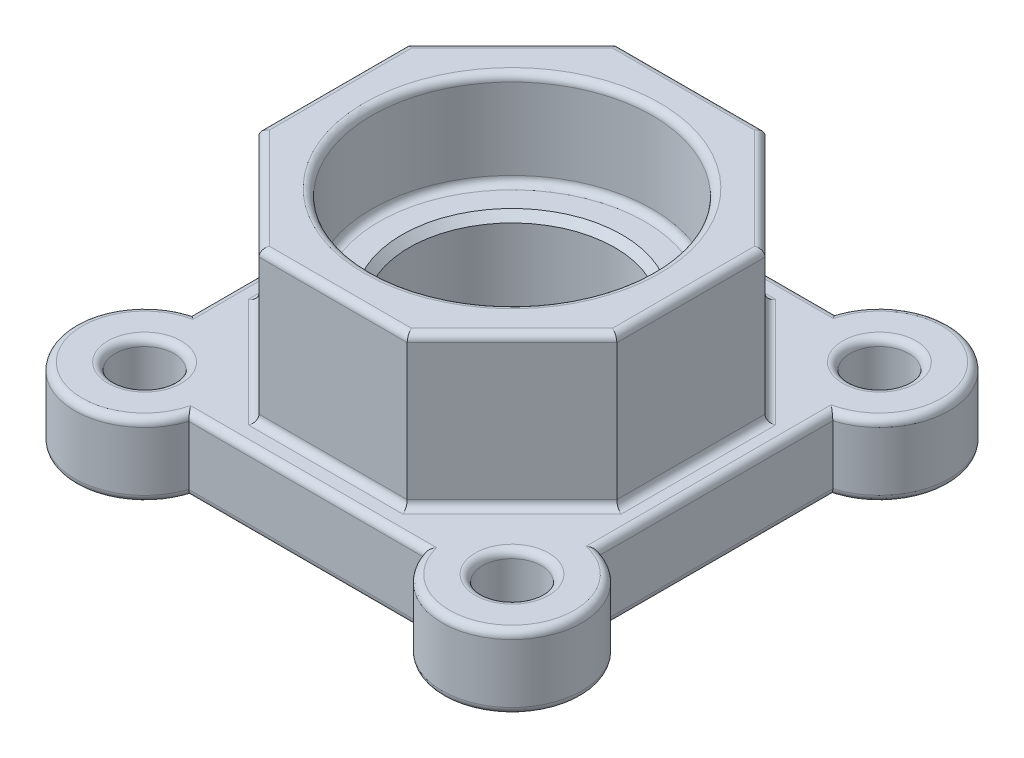
from build123d import *
from build123d.topology import SkipClean

# Parameters (mm, degrees)
SKETCH1_W           = 55.5
SKETCH1_H           = 56
BOSS_EXTRUDE1_DEPTH = 10
BOSS_EXTRUDE2_DEPTH = 10
SKETCH2_3_R         = 4
CUT_EXTRUDE1_DEPTH  = 10
FILLET1_R           = 1
SKETCH3_R           = 19.1
BOSS_EXTRUDE3_DEPTH = 20.5
SKETCH3_3_R         = 19.1
SKETCH3_3_R_2       = 14
BOSS_EXTRUDE4_DEPTH = 7.5
CUT_EXTRUDE2_START  = -5.5
SKETCH3_4_R         = 14
CUT_EXTRUDE2_DEPTH  = 5.5
SKETCH3_5_R         = 12.5
CUT_EXTRUDE3_DEPTH  = 10
CHAMFER1_SIZE       = 1
FILLET2_R           = 1
FILLET3_R           = 1
FILLET4_R           = 1
FILLET5_R           = 1
CHAMFER2_SIZE2      = 1.37373871
CHAMFER2_SIZE       = 0.5


with BuildPart() as part:
    # Sketch1 → Boss-Extrude1 (new body)
    with BuildSketch(Plane(origin=(0, 0, 0), x_dir=(1, 0, 0), z_dir=(0, 1, 0))):
        with Locations((27.75, 28)):
            Rectangle(SKETCH1_W, SKETCH1_H)
    extrude(amount=BOSS_EXTRUDE1_DEPTH)

    # Sketch2 → Boss-Extrude2 (add)
    with BuildSketch(Plane(origin=(0, 10, 0), x_dir=(1, 0, 0), z_dir=(0, 1, 0))):
        with BuildLine():
            Line((0, 50.09526249), (0, 43.90673326))
            ThreePointArc((0, 43.90673326), (8.412375826, 45.371926849), (12.25, 53))
            ThreePointArc((12.25, 53), (12.127682091, 54.519565268), (11.763878189, 56))
            Line((11.763878189, 56), (5.395751311, 56))
            ThreePointArc((5.395751311, 56), (6.395751311, 54.645751311), (6.75, 53))
            ThreePointArc((6.75, 53), (4.33113883, 49.325765386), (0, 50.09526249))
        make_face()
        with BuildLine():
            ThreePointArc((11.763878189, 56), (-4.059612148, 59.624136351), (0, 43.90673326))
            Line((0, 43.90673326), (0, 50.09526249))
            ThreePointArc((0, 50.09526249), (-1.25, 53), (0, 55.90473751))
            Line((0, 55.90473751), (0, 56))
            Line((0, 56), (0.104248689, 56))
            ThreePointArc((0.104248689, 56), (2.75, 57), (5.395751311, 56))
            Line((5.395751311, 56), (11.763878189, 56))
        make_face()
        with BuildLine():
            ThreePointArc((11.763878189, 0), (12.127682091, 1.480434732), (12.25, 3))
            ThreePointArc((12.25, 3), (8.412375826, 10.628073151), (0, 12.09326674))
            Line((0, 12.09326674), (0, 5.90473751))
            ThreePointArc((0, 5.90473751), (4.33113883, 6.674234614), (6.75, 3))
            ThreePointArc((6.75, 3), (6.395751311, 1.354248689), (5.395751311, 0))
            Line((5.395751311, 0), (11.763878189, 0))
        make_face()
        with BuildLine():
            Line((0, 5.90473751), (0, 12.09326674))
            ThreePointArc((0, 12.09326674), (-4.059612148, -3.624136351), (11.763878189, 0))
            Line((11.763878189, 0), (5.395751311, 0))
            ThreePointArc((5.395751311, 0), (2.75, -1), (0.104248689, 0))
            Line((0.104248689, 0), (0, 0))
            Line((0, 0), (0, 0.09526249))
            ThreePointArc((0, 0.09526249), (-1.25, 3), (0, 5.90473751))
        make_face()
        with BuildLine():
            Line((50.104248689, 0), (43.736121811, 0))
            ThreePointArc((43.736121811, 0), (54.269565268, -6.377682091), (62.25, 3))
            ThreePointArc((62.25, 3), (60.378073151, 8.662375826), (55.5, 12.09326674))
            Line((55.5, 12.09326674), (55.5, 5.90473751))
            ThreePointArc((55.5, 5.90473751), (56.424234614, 4.58113883), (56.75, 3))
            ThreePointArc((56.75, 3), (56.424234614, 1.41886117), (55.5, 0.09526249))
            Line((55.5, 0.09526249), (55.5, 0))
            Line((55.5, 0), (55.395751311, 0))
            ThreePointArc((55.395751311, 0), (52.75, -1), (50.104248689, 0))
        make_face()
        with BuildLine():
            ThreePointArc((55.5, 12.09326674), (45.940387852, 9.624136351), (43.736121811, 0))
            Line((43.736121811, 0), (50.104248689, 0))
            ThreePointArc((50.104248689, 0), (49.797171151, 5.69829609), (55.5, 5.90473751))
            Line((55.5, 5.90473751), (55.5, 12.09326674))
        make_face()
        with BuildLine():
            Line((50.104248689, 56), (43.736121811, 56))
            ThreePointArc((43.736121811, 56), (45.940387852, 46.375863649), (55.5, 43.90673326))
            Line((55.5, 43.90673326), (55.5, 50.09526249))
            ThreePointArc((55.5, 50.09526249), (49.797171151, 50.30170391), (50.104248689, 56))
        make_face()
        with BuildLine():
            ThreePointArc((62.25, 53), (54.269565268, 62.377682091), (43.736121811, 56))
            Line((43.736121811, 56), (50.104248689, 56))
            ThreePointArc((50.104248689, 56), (52.75, 57), (55.395751311, 56))
            Line((55.395751311, 56), (55.5, 56))
            Line((55.5, 56), (55.5, 55.90473751))
            ThreePointArc((55.5, 55.90473751), (56.424234614, 54.58113883), (56.75, 53))
            ThreePointArc((56.75, 53), (56.424234614, 51.41886117), (55.5, 50.09526249))
            Line((55.5, 50.09526249), (55.5, 43.90673326))
            ThreePointArc((55.5, 43.90673326), (60.378073151, 47.337624174), (62.25, 53))
        make_face()
    extrude(amount=-BOSS_EXTRUDE2_DEPTH)

    # Sketch2<3> → Cut-Extrude1 (cut)
    with SkipClean():  # the faces are left unmerged after this step: merging them gives an invalid solid
        with BuildSketch(Plane(origin=(0, 10, 0), x_dir=(1, 0, 0), z_dir=(0, 1, 0))):
            with Locations(Location((2.75, 3, 0), (0, 0, 270))):
                Circle(SKETCH2_3_R)
            with Locations(Location((52.75, 3, 0), (0, 0, 270))):
                Circle(SKETCH2_3_R)
            with Locations(Location((52.75, 53, 0), (0, 0, 270))):
                Circle(SKETCH2_3_R)
            with Locations(Location((2.75, 53, 0), (0, 0, 270))):
                Circle(SKETCH2_3_R)
        extrude(amount=-CUT_EXTRUDE1_DEPTH, mode=Mode.SUBTRACT)

    # Fillet1
    fillet1_edges = [part.edges().sort_by_distance(p)[0] for p in [
        (0, 0, -28),
        (0, 10, -28),
        (1.269957777, 10, -49.2838898),
        (-4.059612148, 0, -59.624136351),
        (1.269957777, 0, -49.2838898),
        (-4.059612148, 10, -59.624136351),
        (27.75, 0, 0),
        (27.75, 10, 0),
        (1.335786438, 10, 0.741657387),
        (-4.059612148, 0, 3.624136351),
        (1.335786438, 0, 0.741657387),
        (-4.059612148, 10, 3.624136351),
        (55.5, 0, -28),
        (55.5, 10, -28),
        (51.335786438, 10, 0.741657387),
        (59.559612148, 0, 3.624136351),
        (51.335786438, 0, 0.741657387),
        (59.559612148, 10, 3.624136351),
        (27.75, 0, -56),
        (27.75, 10, -56),
        (49.008342613, 10, -51.585786438),
        (59.559612148, 0, -59.624136351),
        (49.008342613, 0, -51.585786438),
        (59.559612148, 10, -59.624136351),
    ]]
    fillet(fillet1_edges, radius=FILLET1_R)

    # Sketch3 → Boss-Extrude3 (add)
    with SkipClean():  # the faces are left unmerged after this step: merging them gives an invalid solid
        with BuildSketch(Plane(origin=(0, 10, 0), x_dir=(1, 0, 0), z_dir=(0, 1, 0))):
            Polygon((52.1, 17.913899756), (52.1, 38.086100244), (37.836100244, 52.35), (17.663899756, 52.35), (3.4, 38.086100244), (3.4, 17.913899756), (17.663899756, 3.65), (37.836100244, 3.65), align=None)
            with Locations(Location((27.75, 28, 0), (0, 0, 270))):
                Circle(SKETCH3_R, mode=Mode.SUBTRACT)
        extrude(amount=BOSS_EXTRUDE3_DEPTH)

    # Sketch3<3> → Boss-Extrude4 (add)
    with SkipClean():  # the faces are left unmerged after this step: merging them gives an invalid solid
        with BuildSketch(Plane(origin=(0, 10, 0), x_dir=(1, 0, 0), z_dir=(0, 1, 0))):
            with Locations(Location((27.75, 28, 0), (0, 0, 270))):
                Circle(SKETCH3_3_R)
            with Locations(Location((27.75, 28, 0), (0, 0, 270))):
                Circle(SKETCH3_3_R_2, mode=Mode.SUBTRACT)
        extrude(amount=BOSS_EXTRUDE4_DEPTH)

    # Sketch3<4> → Cut-Extrude2 (cut)
    with SkipClean():  # the faces are left unmerged after this step: merging them gives an invalid solid
        with BuildSketch(Plane(origin=(0, 10, 0), x_dir=(1, 0, 0), z_dir=(0, 1, 0)).offset(CUT_EXTRUDE2_START)):
            with Locations(Location((27.75, 28, 0), (0, 0, 270))):
                Circle(SKETCH3_4_R)
        extrude(amount=CUT_EXTRUDE2_DEPTH, mode=Mode.SUBTRACT)

    # Sketch3<5> → Cut-Extrude3 (cut)
    with SkipClean():  # the faces are left unmerged after this step: merging them gives an invalid solid
        with BuildSketch(Plane(origin=(0, 10, 0), x_dir=(1, 0, 0), z_dir=(0, 1, 0))):
            with Locations(Location((27.75, 28, 0), (0, 0, 270))):
                Circle(SKETCH3_5_R)
        extrude(amount=-CUT_EXTRUDE3_DEPTH, mode=Mode.SUBTRACT)

    # Chamfer1
    chamfer1_edges = [part.edges().sort_by_distance(p)[0] for p in [
        (27.75, 17.5, -42),
    ]]
    chamfer(chamfer1_edges, length=CHAMFER1_SIZE)

    # Fillet2
    fillet2_edges = [part.edges().sort_by_distance(p)[0] for p in [
        (52.1, 10, -28),
        (44.968050122, 10, -45.218050122),
        (27.75, 10, -52.35),
        (10.531949878, 10, -45.218050122),
        (3.4, 10, -28),
        (10.531949878, 10, -10.781949878),
        (27.75, 10, -3.65),
        (44.968050122, 10, -10.781949878),
    ]]
    fillet(fillet2_edges, radius=FILLET2_R)

    # Fillet3
    fillet3_edges = [part.edges().sort_by_distance(p)[0] for p in [
        (27.75, 30.5, -47.1),
        (52.1, 30.5, -28),
        (44.968050122, 30.5, -45.218050122),
        (27.75, 30.5, -52.35),
        (10.531949878, 30.5, -45.218050122),
        (3.4, 30.5, -28),
        (10.531949878, 30.5, -10.781949878),
        (27.75, 30.5, -3.65),
        (44.968050122, 30.5, -10.781949878),
    ]]
    fillet(fillet3_edges, radius=FILLET3_R)

    # Fillet4
    fillet4_edges = [part.edges().sort_by_distance(p)[0] for p in [
        (27.75, 17.5, -47.1),
    ]]
    fillet(fillet4_edges, radius=FILLET4_R)

    # Fillet5
    fillet5_edges = [part.edges().sort_by_distance(p)[0] for p in [
        (27.75, 4.5, -42),
    ]]
    fillet(fillet5_edges, radius=FILLET5_R)

    # Chamfer2
    chamfer2_edges = [part.edges().sort_by_distance(p)[0] for p in [
        (27.75, 4.5, -40.5),
    ]]
    chamfer2_side = [part.faces().sort_by_distance(p)[0] for p in [
        (27.75, 4.5, -40.51),
    ]]
    chamfer(chamfer2_edges, length=CHAMFER2_SIZE - 0.0001, length2=CHAMFER2_SIZE2 - 0.0001, reference=chamfer2_side[0])  # a hair under: the kernel refuses the full size


solid = part.part
